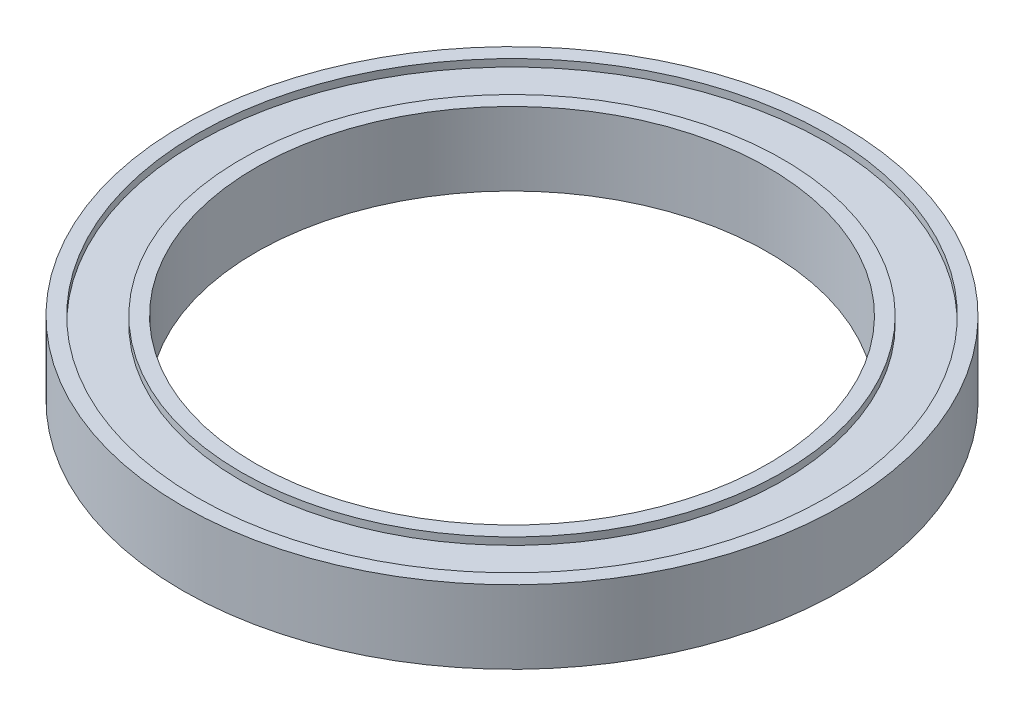
from build123d import *

# Parameters (mm, degrees)
SKETCH1_R           = 45
SKETCH1_R_2         = 35
BOSS_EXTRUDE1_DEPTH = 10
SKETCH2_R           = 43
SKETCH2_R_2         = 37
CUT_EXTRUDE1_DEPTH  = 1
CUT_EXTRUDE2_START  = -1
SKETCH3_R           = 43
SKETCH3_R_2         = 37
CUT_EXTRUDE2_DEPTH  = 1


with BuildPart() as part:
    # Sketch1 → Boss-Extrude1 (new body)
    with BuildSketch(Plane(origin=(0, 0, 0), x_dir=(1, 0, 0), z_dir=(0, 1, 0))):
        Circle(SKETCH1_R)
        Circle(SKETCH1_R_2, mode=Mode.SUBTRACT)
    extrude(amount=BOSS_EXTRUDE1_DEPTH)

    # Sketch2 → Cut-Extrude1 (cut)
    with BuildSketch(Plane(origin=(0, 10, 0), x_dir=(1, 0, 0), z_dir=(0, 1, 0))):
        Circle(SKETCH2_R)
        Circle(SKETCH2_R_2, mode=Mode.SUBTRACT)
    extrude(amount=-CUT_EXTRUDE1_DEPTH, mode=Mode.SUBTRACT)

    # Sketch3 → Cut-Extrude2 (cut)
    with BuildSketch(Plane.XZ.offset(CUT_EXTRUDE2_START)):
        Circle(SKETCH3_R)
        Circle(SKETCH3_R_2, mode=Mode.SUBTRACT)
    extrude(amount=CUT_EXTRUDE2_DEPTH, mode=Mode.SUBTRACT)


solid = part.part
